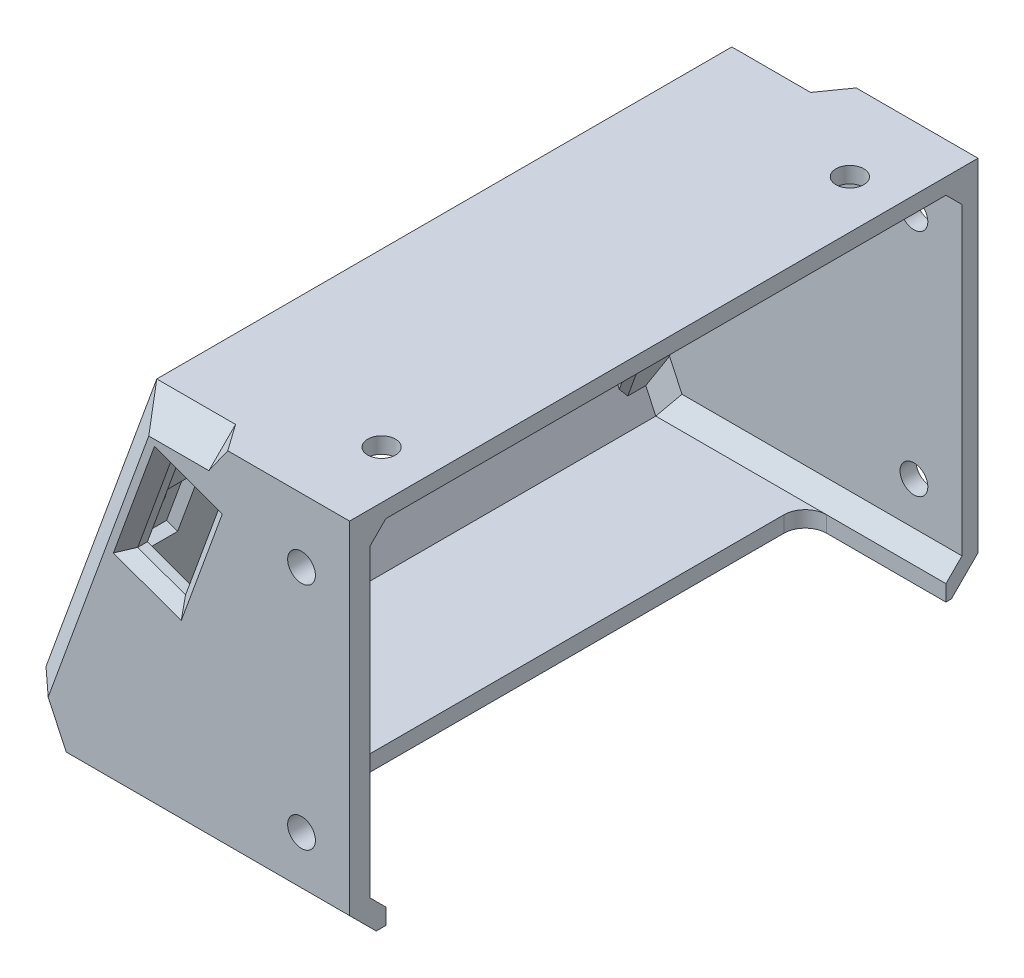
from build123d import *

# Parameters (mm, degrees)
BOSS_EXTRUDE1_DEPTH  = 3.8
BOSS_EXTRUDE2_DEPTH  = 3
BOSS_EXTRUDE3_DEPTH  = 110.9
SKETCH4_W            = 75.5
SKETCH4_H            = 51.77
SKETCH4_R            = 4
SKETCH4_R_2          = 2
CUT_EXTRUDE1_DEPTH   = 3
CUT_EXTRUDE2_DEPTH   = 143.911944121
BOSS_EXTRUDE4_DEPTH  = 110.9
SKETCH7_R            = 2.6
CUT_EXTRUDE3_DEPTH   = 3
SKETCH8_W            = 13
SKETCH8_H            = 13
CUT_EXTRUDE4_DEPTH   = 2.2
SKETCH9_R            = 1.425
BOSS_EXTRUDE5_DEPTH  = 4
BOSS_EXTRUDE6_REACH  = 143.175
SKETCH10_W           = 4
SKETCH10_H           = 7.37
SKETCH10_H_2         = 7.27
BOSS_EXTRUDE7_REACH  = 143.361
SKETCH11_W           = 4
SKETCH11_H           = 7.27
SKETCH11_H_2         = 7.37
CHAMFER8_SIZE        = 1
CUT_EXTRUDE5_START   = -4
SKETCH12_W           = 6.35
SKETCH12_H           = 6.35
CUT_EXTRUDE5_DEPTH   = 3.425989
FILLET1_R            = 1
CHAMFER1_SIZE        = 2
CUT_EXTRUDE6_DEPTH   = 3
CHAMFER2_SIZE        = 1.2
CHAMFER3_SIZE        = 5
CHAMFER4_SIZE        = 3
BOSS_EXTRUDE8_REACH  = 143.233
SKETCH14_W           = 16
SKETCH14_H           = 5
CHAMFER5_SIZE        = 4
CUT_EXTRUDE7_DEPTH   = 3.8
CHAMFER6_SIZE        = 2
SKETCH16_R           = 5
CUT_EXTRUDE8_DEPTH   = 1
CUT_EXTRUDE9_DEPTH   = 142.269501442
SKETCH18_R           = 2.6
CUT_EXTRUDE10_DEPTH  = 140.243204687
CUT_EXTRUDE11_START  = -1.5
SKETCH19_R           = 1.425
CUT_EXTRUDE11_DEPTH  = 1.5
SKETCH21_W           = 20
SKETCH21_H           = 104.9
CUT_EXTRUDE12_DEPTH  = 3
FILLET2_R            = 4
BOSS_EXTRUDE9_DEPTH  = 6.35
SKETCH23_R           = 2.6
BOSS_EXTRUDE12_DEPTH = 3.8
SKETCH23_3_R         = 2.6
CUT_EXTRUDE13_DEPTH  = 142.72462754
BOSS_EXTRUDE13_START = -3
SKETCH24_R           = 2.6
BOSS_EXTRUDE13_DEPTH = 3
SKETCH25_R           = 2.6
BOSS_EXTRUDE14_DEPTH = 3
SKETCH25_4_R         = 2.6
CUT_EXTRUDE14_DEPTH  = 3


with BuildPart() as part:
    # Sketch1 → Boss-Extrude1 (new body)
    with BuildSketch(Plane.XY):
        with BuildLine():
            Line((19, 1), (19, 70))
            Line((19, 70), (10, 70))
            Line((10, 70), (10, 60.6))
            ThreePointArc((10, 60.6), (11.838477631, 59.838477631), (12.6, 58))
            ThreePointArc((12.6, 58), (11.838477631, 56.161522369), (10, 55.4))
            Line((10, 55.4), (10, 17.6))
            ThreePointArc((10, 17.6), (11.838477631, 16.838477631), (12.6, 15))
            ThreePointArc((12.6, 15), (11.838477631, 13.161522369), (10, 12.4))
            Line((10, 12.4), (10, 1))
            Line((10, 1), (19, 1))
        make_face()
        with BuildLine():
            Line((10, 60.6), (10, 70))
            Line((10, 70), (-15.758217619, 70))
            Line((-15.758217619, 70), (-40.872163783, 1))
            Line((-40.872163783, 1), (10, 1))
            Line((10, 1), (10, 12.4))
            ThreePointArc((10, 12.4), (7.4, 15), (10, 17.6))
            Line((10, 17.6), (10, 55.4))
            ThreePointArc((10, 55.4), (7.4, 58), (10, 60.6))
        make_face()
    extrude(amount=-BOSS_EXTRUDE1_DEPTH)



with BuildPart() as body_2:
    # Sketch2 → Boss-Extrude2 (new body)
    with BuildSketch(Plane(origin=(0, 0, -114.7), x_dir=(-1, 0, 0), z_dir=(0, 0, -1))):
        Polygon((40.872163783, 1), (-19, 1), (-19, 70), (15.758217619, 70), align=None)
    extrude(amount=BOSS_EXTRUDE2_DEPTH)


with BuildPart() as part_1:
    add(part.part)

    add(body_2.part)  # Boss-Extrude3 merges body 2
    # Sketch3 → Boss-Extrude3 (add)
    with BuildSketch(Plane(origin=(0, 0, -3.8), x_dir=(-1, 0, 0), z_dir=(0, 0, -1))):
        Polygon((40.872163783, 1), (-19, 1), (-19, 4), (36.587719763, 4), (13.657595004, 67), (-19, 67), (-19, 70), (15.758217619, 70), align=None)
    extrude(amount=BOSS_EXTRUDE3_DEPTH)

    # Sketch4 → Cut-Extrude1 (cut)
    with BuildSketch(Plane(origin=(-36.412422669, 13.253038009, 0), x_dir=(0, 0, 1), z_dir=(-0.9396926207859106, 0.3420201433256628, 0))):
        with Locations((-67.45, 29.912743501)):
            Rectangle(SKETCH4_W, SKETCH4_H)
        with Locations(Location((-12.65, 28.677743501, 0), (0, 0, 270))):
            Circle(SKETCH4_R)
        with Locations(Location((-13.8, 8.727743501, 0), (0, 0, 270))):
            Circle(SKETCH4_R_2)
    extrude(amount=-CUT_EXTRUDE1_DEPTH, mode=Mode.SUBTRACT)

    # Sketch5 → Cut-Extrude2 (cut, through all)
    with BuildSketch(Plane.XY):
        Polygon((-36.504520972, 13), (-30.908829074, 1), (-40.872163783, 1), align=None)
    extrude(amount=-CUT_EXTRUDE2_DEPTH, mode=Mode.SUBTRACT)

    # Sketch6 → Boss-Extrude4 (add)
    with BuildSketch(Plane(origin=(0, 0, -3.8), x_dir=(-1, 0, 0), z_dir=(0, 0, -1))):
        Polygon((34.71150354, 9.154861708), (32.307752049, 4), (28.997618292, 4), (33.260434964, 13.141639854), align=None)
    extrude(amount=BOSS_EXTRUDE4_DEPTH)

    # Sketch7 → Cut-Extrude3 (cut)
    with BuildSketch(Plane(origin=(0, 70, 0), x_dir=(1, 0, 0), z_dir=(0, 1, 0))):
        with Locations(Location((10, 102.7, 0), (0, 0, 270))):
            Circle(SKETCH7_R)
        with Locations(Location((10, 15, 0), (0, 0, 270))):
            Circle(SKETCH7_R)
    extrude(amount=-CUT_EXTRUDE3_DEPTH, mode=Mode.SUBTRACT)

    # Sketch8 → Cut-Extrude4 (cut)
    with BuildSketch(Plane(origin=(-33.593344806, 12.226977579, 0), x_dir=(0, 0, -1), z_dir=(0.9396926207859106, -0.34202014332566294, 0))):
        with Locations((12.65, 28.677743501)):
            Rectangle(SKETCH8_W, SKETCH8_H)
    extrude(amount=-CUT_EXTRUDE4_DEPTH, mode=Mode.SUBTRACT)

    # Sketch9 → Boss-Extrude5 (add)
    # profile 1 of 4: a face of its own
    with BuildSketch(Plane(origin=(-33.593344806, 12.226977579, 0), x_dir=(0, 0, -1), z_dir=(0.9396926207859106, -0.34202014332566294, 0))):
        with BuildLine():
            Line((11.07, 5.197743501), (11.07, 0.973363262))
            Line((11.07, 0.973363262), (3.8, 0.973363262))
            Line((3.8, 0.973363262), (3.8, 8.947743501))
            Line((3.8, 8.947743501), (7.32, 8.947743501))
            ThreePointArc((7.32, 8.947743501), (9.971650429, 7.84939393), (11.07, 5.197743501))
        make_face()
        with Locations(Location((7.32, 5.197743501, 0), (0, 0, 90))):
            Circle(SKETCH9_R, mode=Mode.SUBTRACT)
    # profile 2 of 4: a face of its own
    with BuildSketch(Plane(origin=(-33.593344806, 12.226977579, 0), x_dir=(0, 0, -1), z_dir=(0.9396926207859106, -0.34202014332566294, 0))):
        with BuildLine():
            Line((7.32, 50.877743501), (3.8, 50.877743501))
            Line((3.8, 50.877743501), (3.8, 58.288232992))
            Line((3.8, 58.288232992), (11.07, 58.288232992))
            Line((11.07, 58.288232992), (11.07, 54.627743501))
            ThreePointArc((11.07, 54.627743501), (9.971650429, 51.976093072), (7.32, 50.877743501))
        make_face()
        with Locations(Location((7.32, 54.627743501, 0), (0, 0, 90))):
            Circle(SKETCH9_R, mode=Mode.SUBTRACT)
    # profile 3 of 4: a face of its own
    with BuildSketch(Plane(origin=(-33.593344806, 12.226977579, 0), x_dir=(0, 0, -1), z_dir=(0.9396926207859106, -0.34202014332566294, 0))):
        with BuildLine():
            Line((107.33, 54.627743501), (107.33, 58.288232992))
            Line((107.33, 58.288232992), (114.7, 58.288232992))
            Line((114.7, 58.288232992), (114.7, 50.877743501))
            Line((114.7, 50.877743501), (111.08, 50.877743501))
            ThreePointArc((111.08, 50.877743501), (108.428349571, 51.976093072), (107.33, 54.627743501))
        make_face()
        with Locations(Location((111.08, 54.627743501, 0), (0, 0, 90))):
            Circle(SKETCH9_R, mode=Mode.SUBTRACT)
    # profile 4 of 4: a face of its own
    with BuildSketch(Plane(origin=(-33.593344806, 12.226977579, 0), x_dir=(0, 0, -1), z_dir=(0.9396926207859106, -0.34202014332566294, 0))):
        with BuildLine():
            Line((111.08, 8.947743501), (114.7, 8.947743501))
            Line((114.7, 8.947743501), (114.7, 0.973363262))
            Line((114.7, 0.973363262), (107.33, 0.973363262))
            Line((107.33, 0.973363262), (107.33, 5.197743501))
            ThreePointArc((107.33, 5.197743501), (108.428349571, 7.84939393), (111.08, 8.947743501))
        make_face()
        with Locations(Location((111.08, 5.197743501, 0), (0, 0, 90))):
            Circle(SKETCH9_R, mode=Mode.SUBTRACT)
    extrude(amount=BOSS_EXTRUDE5_DEPTH)

    # Sketch10 → Boss-Extrude6 (add, up to next)
    with BuildSketch(Plane(origin=(19.935749802, 54.773022421, 0), x_dir=(0.9396926207859105, -0.342020143325663, 0), z_dir=(0.34202014332566294, 0.9396926207859104, 0)), mode=Mode.PRIVATE) as boss_extrude6_sk1:
        with Locations((-33.749290846, 111.015)):
            Rectangle(SKETCH10_W, SKETCH10_H)
    boss_extrude6_tool1 = extrude(boss_extrude6_sk1.sketch, amount=BOSS_EXTRUDE6_REACH, mode=Mode.PRIVATE) - part_1.part
    # Sketch10 → Boss-Extrude6 (add, up to next)
    with BuildSketch(Plane(origin=(19.935749802, 54.773022421, 0), x_dir=(0.9396926207859105, -0.342020143325663, 0), z_dir=(0.34202014332566294, 0.9396926207859104, 0)), mode=Mode.PRIVATE) as boss_extrude6_sk2:
        with Locations((-33.749290846, 7.435)):
            Rectangle(SKETCH10_W, SKETCH10_H_2)
    boss_extrude6_tool2 = extrude(boss_extrude6_sk2.sketch, amount=BOSS_EXTRUDE6_REACH, mode=Mode.PRIVATE) - part_1.part
    add(boss_extrude6_tool1.solids().sort_by_distance((-11.77821, 66.31596, -111.015))[0])
    add(boss_extrude6_tool2.solids().sort_by_distance((-11.77821, 66.31596, -7.435))[0])

    # Sketch11 → Boss-Extrude7 (add, up to next)
    with BuildSketch(Plane(origin=(0.332909843, 0.914662275, 0), x_dir=(0.9396926207859105, -0.342020143325663, 0), z_dir=(-0.34202014332566294, -0.9396926207859104, 0)), mode=Mode.PRIVATE) as boss_extrude7_sk1:
        with Locations((-33.749290846, -7.435)):
            Rectangle(SKETCH11_W, SKETCH11_H)
    boss_extrude7_tool1 = extrude(boss_extrude7_sk1.sketch, amount=BOSS_EXTRUDE7_REACH, mode=Mode.PRIVATE) - part_1.part
    # Sketch11 → Boss-Extrude7 (add, up to next)
    with BuildSketch(Plane(origin=(0.332909843, 0.914662275, 0), x_dir=(0.9396926207859105, -0.342020143325663, 0), z_dir=(-0.34202014332566294, -0.9396926207859104, 0)), mode=Mode.PRIVATE) as boss_extrude7_sk2:
        with Locations((-33.749290846, -111.015)):
            Rectangle(SKETCH11_W, SKETCH11_H_2)
    boss_extrude7_tool2 = extrude(boss_extrude7_sk2.sketch, amount=BOSS_EXTRUDE7_REACH, mode=Mode.PRIVATE) - part_1.part
    add(boss_extrude7_tool1.solids().sort_by_distance((-31.38105, 12.4576, -7.435))[0])
    add(boss_extrude7_tool2.solids().sort_by_distance((-31.38105, 12.4576, -111.015))[0])

    # Chamfer8
    chamfer8_edges = [part_1.edges().sort_by_distance(p)[0] for p in [
        (-12.057703521, 59.700448122, -108.428349571),
        (-12.433361199, 58.668337136, -112.89),
        (-10.275834788, 64.596092232, -107.33),
        (-12.057703521, 59.700448122, -9.971650429),
        (-10.275834788, 64.596092232, -11.07),
        (-12.433361199, 58.668337136, -5.56),
        (-27.149923486, 18.23491456, -9.971650429),
        (-26.774265809, 19.267025546, -5.56),
        (-29.4632932, 11.878983508, -11.07),
        (-27.149923486, 18.23491456, -108.428349571),
        (-29.4632932, 11.878983508, -107.33),
        (-26.774265809, 19.267025546, -112.89),
    ]]
    chamfer(chamfer8_edges, length=CHAMFER8_SIZE)

    # Sketch12 → Cut-Extrude5 (cut)
    with BuildSketch(Plane(origin=(-29.834574323, 10.858897006, 0), x_dir=(0, 0, -1), z_dir=(0.9396926207859105, -0.34202014332566305, 0)).offset(CUT_EXTRUDE5_START)):
        with Locations((13.8, 8.727743501)):
            Rectangle(SKETCH12_W, SKETCH12_H)
    extrude(amount=CUT_EXTRUDE5_DEPTH, mode=Mode.SUBTRACT)

    # Fillet1
    # the kernel refuses this fillet: 1 mm, written as the material it takes off along each edge
    with BuildSketch(Plane(origin=(-27.644256601, 17.478579818, -10.625), x_dir=(0.2943185264187609, 0.80863350546272, 0.5094000970256704), z_dir=(-0.9396926207859106, 0.34202014332566294, 0))) as fillet1_piece_1:
        with BuildLine():
            CenterArc((0.275308986, -0.999102615), FILLET1_R, 87.572497981, 33.051380785)
            Line((-0.234091111, -0.138572812), (-0.244279113, -0.121362216))
            Line((-0.244279113, -0.121362216), (-0.010188002, 0.017210596))
            Line((-0.010188002, 0.017210596), (-0.000847105, 0.019982052))
            ThreePointArc((-0.000847105, 0.019982052), (0.158832107, 0.023365195), (0.318511319, 0.019982052))
            Line((0.318511319, 0.019982052), (0.317664215, 0))
        make_face()
    extrude(amount=3.794160537, mode=Mode.SUBTRACT)
    with BuildSketch(Plane(origin=(-26.920507283, 15.707369552, -11.05315885), x_dir=(-0.34195007184608783, -0.9395001009780302, -0.020241260502412407), z_dir=(-0.9396926207859106, 0.34202014332566294, 0))) as fillet1_piece_2:
        with BuildLine():
            CenterArc((0.811779547, 0.999795125), FILLET1_R, 214.870532787, 56.289285219)
            Line((-0.008666475, 0.428071131), (-0.090711077, 0.370898732))
            ThreePointArc((-0.090711077, 0.370898732), (-0.10431275, 0.212011439), (-0.099979512, -0.002024126))
            Line((-0.099979512, -0.002024126), (-0.007449691, -0.099722124))
            ThreePointArc((-0.007449691, -0.099722124), (0.357292281, -0.109631565), (0.834044934, -0.099979512))
            Line((0.834044934, -0.099979512), (0.832020808, 0))
        make_face()
    extrude(amount=5.080052019, mode=Mode.SUBTRACT)

    # Chamfer1
    chamfer1_edges = [part_1.edges().sort_by_distance(p)[0] for p in [
        (-17.328470439, 65.685765833, -67.45),
        (-26.181661849, 41.361822344, -29.7),
        (-26.181661849, 41.361822344, -105.2),
        (-35.034853259, 17.037878855, -67.45),
    ]]
    chamfer(chamfer1_edges, length=CHAMFER1_SIZE)

    # Sketch13 → Cut-Extrude6 (cut)
    with BuildSketch(Plane(origin=(0, 0, -117.7), x_dir=(-1, 0, 0), z_dir=(0, 0, -1))):
        Polygon((8.977293989, 50.620977355), (13.393849306, 52.228472029), (22.888328485, 26.142604876), (18.471773167, 24.535110202), align=None)
    extrude(amount=-CUT_EXTRUDE6_DEPTH, mode=Mode.SUBTRACT)

    # Chamfer2
    chamfer2_edges = [part_1.edges().sort_by_distance(p)[0] for p in [
        (-13.724533578, 37.578043779, -117.7),
        (-20.680050826, 25.338857539, -117.7),
        (-18.141088896, 39.185538452, -117.7),
        (-11.185571647, 51.424724692, -117.7),
    ]]
    chamfer(chamfer2_edges, length=CHAMFER2_SIZE)

    # Chamfer3
    chamfer3_edges = [part_1.edges().sort_by_distance(p)[0] for p in [
        (1.620891191, 70, -117.7),
        (-5.954414537, 1, -117.7),
        (-26.131369296, 41.5, -117.7),
        (-5.954414537, 1, 0),
        (-33.706675023, 7, -117.7),
        (-33.706675023, 7, 0),
        (-26.131369296, 41.5, 0),
        (1.620891191, 70, 0),
    ]]
    chamfer(chamfer3_edges, length=CHAMFER3_SIZE)

    # Chamfer4
    # the kernel refuses this chamfer: 3 mm, written as the material it adds along each edge
    with BuildSketch(Plane(origin=(19, 4, -3.8), x_dir=(0, -0.02749587661058634, -0.9996219169112968), z_dir=(-1, 0, 0))) as chamfer4_piece_1_section:
        Polygon((CHAMFER4_SIZE * 0.999621916911, -CHAMFER4_SIZE * 0.0274958766106), (-CHAMFER4_SIZE * 0.0274958766106, -CHAMFER4_SIZE * 0.999621916911), (0, 0), align=None)
    chamfer4_piece_1 = extrude(amount=55.712667256, mode=Mode.PRIVATE)
    chamfer4_piece_1 = split(chamfer4_piece_1, bisect_by=Plane(origin=(-25.137990251, -4.276999044, -4.797594563), z_dir=(0.9063077870366467, 0.4226182617407065, 0)), keep=Keep.TOP, mode=Mode.PRIVATE)
    add(chamfer4_piece_1)
    with BuildSketch(Plane(origin=(-25.737097709, -2.992208953, -3.8), x_dir=(0.905965127389208, 0.42245847692296523, 0.027495876610586324), z_dir=(-0.4226182617407065, 0.9063077870366467, 0))) as chamfer4_piece_2_section:
        Polygon((CHAMFER4_SIZE * 0.999621916911, CHAMFER4_SIZE * 0.0274958766106), (-CHAMFER4_SIZE * 0.0274958766106, CHAMFER4_SIZE * 0.999621916911), (0, 0), align=None)
    chamfer4_piece_2 = extrude(amount=19.859927236, mode=Mode.PRIVATE)
    chamfer4_piece_2 = split(chamfer4_piece_2, bisect_by=Plane(origin=(-29.041476178, 4, -4.737827612), z_dir=(0, 1, 0)), keep=Keep.TOP, mode=Mode.PRIVATE)
    add(chamfer4_piece_2)
    with BuildSketch(Plane(origin=(-30.533036292, 20.63510612, -3.8), x_dir=(0.9393373388974123, -0.3418908312934755, 0.027495876610586407), z_dir=(0.3420201433256628, 0.9396926207859106, 0))) as chamfer4_piece_3_section:
        Polygon((CHAMFER4_SIZE * 0.999621916911, CHAMFER4_SIZE * 0.0274958766106), (-CHAMFER4_SIZE * 0.0274958766106, CHAMFER4_SIZE * 0.999621916911), (0, 0), align=None)
    chamfer4_piece_3 = extrude(amount=41.93, mode=Mode.PRIVATE)
    chamfer4_piece_3 = split(chamfer4_piece_3, bisect_by=Plane(origin=(-29.414385604, 21.405001356, -6.15), z_dir=(0, 0, 1)), keep=Keep.TOP, mode=Mode.PRIVATE)
    add(chamfer4_piece_3)
    with BuildSketch(Plane(origin=(-30.533036292, 20.63510612, -3.8), x_dir=(0.9393373388974123, -0.3418908312934755, 0.027495876610586407), z_dir=(0.3420201433256628, 0.9396926207859106, 0))) as chamfer4_piece_4_section:
        Polygon((CHAMFER4_SIZE * 0.999621916911, CHAMFER4_SIZE * 0.0274958766106), (-CHAMFER4_SIZE * 0.0274958766106, CHAMFER4_SIZE * 0.999621916911), (0, 0), align=None)
    chamfer4_piece_4 = extrude(amount=49.645048964, mode=Mode.PRIVATE)
    chamfer4_piece_4 = split(chamfer4_piece_4, bisect_by=Plane(origin=(-25.812434281, 32.99601943, -6.370883234), z_dir=(-0.3420201433256629, -0.9396926207859105, 0)), keep=Keep.TOP, mode=Mode.PRIVATE)
    add(chamfer4_piece_4)
    with BuildSketch(Plane(origin=(-33.171738444, 13.385331539, -3.8), x_dir=(0.9393373388974121, -0.34189083129347536, 0.02749587661058633), z_dir=(0.3420201433256628, 0.9396926207859106, 0))) as chamfer4_piece_5_section:
        Polygon((CHAMFER4_SIZE * 0.999621916911, CHAMFER4_SIZE * 0.0274958766106), (-CHAMFER4_SIZE * 0.0274958766106, CHAMFER4_SIZE * 0.999621916911), (0, 0), align=None)
    chamfer4_piece_5 = extrude(amount=49.645048964, mode=Mode.PRIVATE)
    chamfer4_piece_5 = split(chamfer4_piece_5, bisect_by=Plane(origin=(-21.356540251, 45.208517678, -6.365758065), z_dir=(0.3420201433256629, 0.9396926207859105, 0)), keep=Keep.TOP, mode=Mode.PRIVATE)
    add(chamfer4_piece_5)
    with BuildSketch(Plane(origin=(-30.533036292, 20.63510612, -114.7), x_dir=(0.9393373388974123, -0.3418908312934755, -0.027495876610582205), z_dir=(0.3420201433256628, 0.9396926207859106, 0))) as chamfer4_piece_6:
        Polygon((CHAMFER4_SIZE * 0.999621916911, -CHAMFER4_SIZE * 0.0274958766106), (-CHAMFER4_SIZE * 0.0274958766106, -CHAMFER4_SIZE * 0.999621916911), (0, 0), align=None)
    extrude(amount=41.93)
    with BuildSketch(Plane(origin=(-25.737097709, -2.992208953, -114.7), x_dir=(0.905965127389208, 0.42245847692296506, -0.027495876610586778), z_dir=(-0.4226182617407065, 0.9063077870366467, 0))) as chamfer4_piece_7_section:
        Polygon((CHAMFER4_SIZE * 0.999621916911, -CHAMFER4_SIZE * 0.0274958766106), (-CHAMFER4_SIZE * 0.0274958766106, -CHAMFER4_SIZE * 0.999621916911), (0, 0), align=None)
    chamfer4_piece_7 = extrude(amount=19.859927236, mode=Mode.PRIVATE)
    chamfer4_piece_7 = split(chamfer4_piece_7, bisect_by=Plane(origin=(-29.041476178, 4, -113.762172388), z_dir=(0, 1, 0)), keep=Keep.TOP, mode=Mode.PRIVATE)
    chamfer4_piece_7 = split(chamfer4_piece_7, bisect_by=Plane(origin=(-31.060933685, 7.489502351, -113.762172388), z_dir=(0.9396926207859105, -0.342020143325663, 0)), keep=Keep.TOP, mode=Mode.PRIVATE)
    add(chamfer4_piece_7)
    with BuildSketch(Plane(origin=(19, 4, -114.7), x_dir=(0, -0.027495876610586334, 0.9996219169112968), z_dir=(-1, 0, 0))) as chamfer4_piece_8_section:
        Polygon((CHAMFER4_SIZE * 0.999621916911, CHAMFER4_SIZE * 0.0274958766106), (-CHAMFER4_SIZE * 0.0274958766106, CHAMFER4_SIZE * 0.999621916911), (0, 0), align=None)
    chamfer4_piece_8 = extrude(amount=55.712667256, mode=Mode.PRIVATE)
    chamfer4_piece_8 = split(chamfer4_piece_8, bisect_by=Plane(origin=(-25.137990251, -4.276999044, -113.702405437), z_dir=(0.9063077870366467, 0.4226182617407065, 0)), keep=Keep.TOP, mode=Mode.PRIVATE)
    add(chamfer4_piece_8)
    with BuildSketch(Plane(origin=(-17.115932878, 67, -114.7), x_dir=(0, 0.027495876610586768, 0.9996219169112968), z_dir=(1, 0, 0))) as chamfer4_piece_9_section:
        Polygon((CHAMFER4_SIZE * 0.999621916911, CHAMFER4_SIZE * 0.0274958766106), (-CHAMFER4_SIZE * 0.0274958766106, CHAMFER4_SIZE * 0.999621916911), (0, 0), align=None)
    chamfer4_piece_9 = extrude(amount=36.115932878, mode=Mode.PRIVATE)
    chamfer4_piece_9 = split(chamfer4_piece_9, bisect_by=Plane(origin=(-8.08459781, 70.616466351, -113.703163324), z_dir=(0.9396926207859105, -0.34202014332566305, -1.928202810746551e-15)), keep=Keep.TOP, mode=Mode.PRIVATE)
    add(chamfer4_piece_9)
    with BuildSketch(Plane(origin=(-17.115932878, 67, -3.8), x_dir=(0, -0.9996219169112968, 0.027495876610586334), z_dir=(1, 0, 0))) as chamfer4_piece_10_section:
        Polygon((CHAMFER4_SIZE * 0.999621916911, CHAMFER4_SIZE * 0.0274958766106), (-CHAMFER4_SIZE * 0.0274958766106, CHAMFER4_SIZE * 0.999621916911), (0, 0), align=None)
    chamfer4_piece_10 = extrude(amount=36.115932878, mode=Mode.PRIVATE)
    chamfer4_piece_10 = split(chamfer4_piece_10, bisect_by=Plane(origin=(-8.08459781, 70.616466351, -4.796836676), z_dir=(0.9396926207859106, -0.34202014332566294, 0)), keep=Keep.TOP, mode=Mode.PRIVATE)
    add(chamfer4_piece_10)

    # Sketch14 → Boss-Extrude8 (add, up to next)
    with BuildSketch(Plane(origin=(0, 70, 0), x_dir=(1, 0, 0), z_dir=(0, 1, 0)), mode=Mode.PRIVATE) as boss_extrude8_sk1:
        with Locations((11, 115.2)):
            Rectangle(SKETCH14_W, SKETCH14_H)
    boss_extrude8_tool1 = extrude(boss_extrude8_sk1.sketch, amount=-BOSS_EXTRUDE8_REACH, mode=Mode.PRIVATE) - part_1.part
    # Sketch14 → Boss-Extrude8 (add, up to next)
    with BuildSketch(Plane(origin=(0, 70, 0), x_dir=(1, 0, 0), z_dir=(0, 1, 0)), mode=Mode.PRIVATE) as boss_extrude8_sk2:
        with Locations((11, 2.5)):
            Rectangle(SKETCH14_W, SKETCH14_H)
    boss_extrude8_tool2 = extrude(boss_extrude8_sk2.sketch, amount=-BOSS_EXTRUDE8_REACH, mode=Mode.PRIVATE) - part_1.part
    add(boss_extrude8_tool1.solids().sort_by_distance((11, 70, -115.2))[0])
    add(boss_extrude8_tool2.solids().sort_by_distance((11, 70, -2.5))[0])

    # Chamfer5
    # the kernel refuses this chamfer: 4 mm, written as the material it adds along each edge
    with BuildSketch(Plane(origin=(3, 57.726182081, -124.973817919), x_dir=(-0.9996219169112968, -0.019442520806012935, 0.019442520806012935), z_dir=(0, 0.7071067811865476, 0.7071067811865476))) as chamfer5_piece_1_section:
        Polygon((CHAMFER5_SIZE * 0.999621916911, -CHAMFER5_SIZE * 0.0274958766106), (-CHAMFER5_SIZE * 0.0274958766106, -CHAMFER5_SIZE * 0.999621916911), (0, 0), align=None)
    chamfer5_piece_1 = extrude(amount=27.644531716, mode=Mode.PRIVATE)
    chamfer5_piece_1 = split(chamfer5_piece_1, bisect_by=Plane(origin=(1.439211999, 68.113286918, -117.7), z_dir=(0, 0, 1)), keep=Keep.TOP, mode=Mode.PRIVATE)
    chamfer5_piece_1 = split(chamfer5_piece_1, bisect_by=Plane(origin=(1.439211999, 70, -115.813286918), z_dir=(0, -1, 0)), keep=Keep.TOP, mode=Mode.PRIVATE)
    add(chamfer5_piece_1)
    with BuildSketch(Plane(origin=(3, 57.726182081, 7.273817919), x_dir=(-0.9996219169112968, -0.019442520806014007, -0.019442520806014007), z_dir=(0, 0.7071067811865476, -0.7071067811865476))) as chamfer5_piece_2_section:
        Polygon((CHAMFER5_SIZE * 0.999621916911, CHAMFER5_SIZE * 0.0274958766106), (-CHAMFER5_SIZE * 0.0274958766106, CHAMFER5_SIZE * 0.999621916911), (0, 0), align=None)
    chamfer5_piece_2 = extrude(amount=27.644531716, mode=Mode.PRIVATE)
    chamfer5_piece_2 = split(chamfer5_piece_2, bisect_by=Plane(origin=(1.439211999, 68.113286918, 0), z_dir=(0, 0, -1)), keep=Keep.TOP, mode=Mode.PRIVATE)
    chamfer5_piece_2 = split(chamfer5_piece_2, bisect_by=Plane(origin=(1.439211999, 70, -1.886713082), z_dir=(0, -1, 0)), keep=Keep.TOP, mode=Mode.PRIVATE)
    add(chamfer5_piece_2)

    # Sketch15 → Cut-Extrude7 (cut)
    with BuildSketch(Plane.XY):
        Polygon((-9.989125057, 61.290494584), (-1.043251307, 58.034462819), (-7.370623958, 40.650149335), (-16.316497708, 43.906181099), align=None)
    extrude(amount=-CUT_EXTRUDE7_DEPTH, mode=Mode.SUBTRACT)

    # Chamfer6
    chamfer6_edges = [part_1.edges().sort_by_distance(p)[0] for p in [
        (-13.152811383, 52.598337841, 0),
        (-11.843560833, 42.278165217, 0),
        (-4.206937633, 49.342306077, 0),
        (-5.516188182, 59.662478702, 0),
    ]]
    chamfer(chamfer6_edges, length=CHAMFER6_SIZE)

    # Sketch16 → Cut-Extrude8 (cut)
    with BuildSketch(Plane(origin=(-33.593344806, 12.226977579, 0), x_dir=(0, 0, -1), z_dir=(0.9396926207859106, -0.34202014332566294, 0))):
        with Locations(Location((12.87, 44.617743501, 0), (0, 0, 90))):
            Circle(SKETCH16_R)
    extrude(amount=-CUT_EXTRUDE8_DEPTH, mode=Mode.SUBTRACT)

    # Sketch17 → Cut-Extrude9 (cut, through all)
    with BuildSketch(Plane(origin=(-33.593344806, 12.226977579, 0), x_dir=(0, 0, -1), z_dir=(0.9396926207859106, -0.34202014332566294, 0))):
        with BuildLine():
            Line((7.87, 45.617743501), (17.87, 45.617743501))
            ThreePointArc((17.87, 45.617743501), (18.87, 44.617743501), (17.87, 43.617743501))
            Line((17.87, 43.617743501), (7.87, 43.617743501))
            ThreePointArc((7.87, 43.617743501), (6.87, 44.617743501), (7.87, 45.617743501))
        make_face()
        with BuildLine():
            Line((10.37, 49.117743501), (15.37, 49.117743501))
            ThreePointArc((15.37, 49.117743501), (16.37, 48.117743501), (15.37, 47.117743501))
            Line((15.37, 47.117743501), (10.37, 47.117743501))
            ThreePointArc((10.37, 47.117743501), (9.37, 48.117743501), (10.37, 49.117743501))
        make_face()
        with BuildLine():
            Line((10.37, 40.117743501), (15.37, 40.117743501))
            ThreePointArc((15.37, 40.117743501), (16.37, 41.117743501), (15.37, 42.117743501))
            Line((15.37, 42.117743501), (10.37, 42.117743501))
            ThreePointArc((10.37, 42.117743501), (9.37, 41.117743501), (10.37, 40.117743501))
        make_face()
    extrude(amount=-CUT_EXTRUDE9_DEPTH, mode=Mode.SUBTRACT)

    # Sketch18 → Cut-Extrude10 (cut, through all)
    with BuildSketch(Plane.XY.offset(-114.7)):
        with Locations((10, 15)):
            Circle(SKETCH18_R)
    extrude(amount=-CUT_EXTRUDE10_DEPTH, mode=Mode.SUBTRACT)

    # Sketch19 → Cut-Extrude11 (cut)
    with BuildSketch(Plane(origin=(-33.593344806, 12.226977579, 0), x_dir=(0, 0, -1), z_dir=(0.9396926207859106, -0.34202014332566294, 0)).offset(CUT_EXTRUDE11_START)):
        with Locations(Location((111.08, 5.197743501, 0), (0, 0, 90))):
            Circle(SKETCH19_R)
        with Locations(Location((7.32, 5.197743501, 0), (0, 0, 90))):
            Circle(SKETCH19_R)
        with Locations(Location((111.08, 54.627743501, 0), (0, 0, 90))):
            Circle(SKETCH19_R)
        with Locations(Location((7.32, 54.627743501, 0), (0, 0, 90))):
            Circle(SKETCH19_R)
    extrude(amount=CUT_EXTRUDE11_DEPTH, mode=Mode.SUBTRACT)

    # Sketch21 → Cut-Extrude12 (cut)
    with BuildSketch(Plane(origin=(0, 4, 0), x_dir=(1, 0, 0), z_dir=(0, 1, 0))):
        with Locations((9, 59.25)):
            Rectangle(SKETCH21_W, SKETCH21_H)
    extrude(amount=-CUT_EXTRUDE12_DEPTH, mode=Mode.SUBTRACT)

    # Fillet2
    fillet2_edges = [part_1.edges().sort_by_distance(p)[0] for p in [
        (-1, 2.5, -111.7),
        (-1, 2.5, -6.8),
    ]]
    fillet(fillet2_edges, radius=FILLET2_R)

    # Sketch22 → Boss-Extrude9 (add)
    with BuildSketch(Plane(origin=(19, 0, 0), x_dir=(0, 0, -1), z_dir=(1, 0, 0))):
        Polygon((114.7, 7), (111.7, 4), (111.7, 1), (112.7, 1), (117.7, 6), (117.7, 70), (0, 70), (0, 6), (5, 1), (6.8, 1), (6.8, 4), (3.8, 7), (3.8, 64), (6.8, 67), (111.7, 67), (114.7, 64), align=None)
    extrude(amount=BOSS_EXTRUDE9_DEPTH)

    # Sketch23 → Boss-Extrude12 (add)
    with BuildSketch(Plane.XY):
        with Locations((10, 15)):
            Circle(SKETCH23_R)
        with Locations((10, 58)):
            Circle(SKETCH23_R)
    extrude(amount=-BOSS_EXTRUDE12_DEPTH)

    # Sketch23<3> → Cut-Extrude13 (cut, through all)
    with BuildSketch(Plane.XY):
        with Locations((16.35, 58)):
            Circle(SKETCH23_3_R)
        with Locations((16.35, 15)):
            Circle(SKETCH23_3_R)
    extrude(amount=-CUT_EXTRUDE13_DEPTH, mode=Mode.SUBTRACT)

    # Sketch24 → Boss-Extrude13 (add)
    with BuildSketch(Plane(origin=(0, 0, -117.7), x_dir=(-1, 0, 0), z_dir=(0, 0, -1)).offset(BOSS_EXTRUDE13_START)):
        with Locations((-10, 15)):
            Circle(SKETCH24_R)
    extrude(amount=BOSS_EXTRUDE13_DEPTH)

    # Sketch25 → Boss-Extrude14 (add)
    with BuildSketch(Plane(origin=(0, 70, 0), x_dir=(1, 0, 0), z_dir=(0, 1, 0))):
        with Locations((10, 15)):
            Circle(SKETCH25_R)
        with Locations((10, 102.7)):
            Circle(SKETCH25_R)
    extrude(amount=-BOSS_EXTRUDE14_DEPTH)

    # Sketch25<4> → Cut-Extrude14 (cut)
    with BuildSketch(Plane(origin=(0, 70, 0), x_dir=(1, 0, 0), z_dir=(0, 1, 0))):
        with Locations(Location((16.35, 102.7, 0), (0, 0, 270))):
            Circle(SKETCH25_4_R)
        with Locations(Location((16.35, 15, 0), (0, 0, 270))):
            Circle(SKETCH25_4_R)
    extrude(amount=-CUT_EXTRUDE14_DEPTH, mode=Mode.SUBTRACT)


solid = part_1.part
